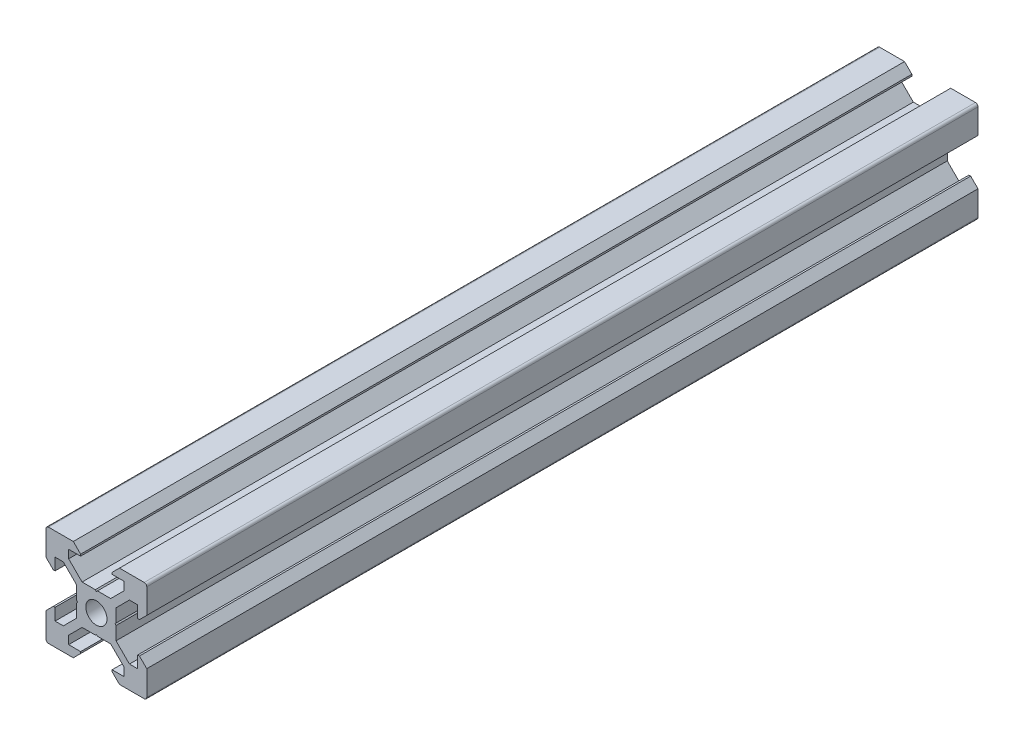
from build123d import *

# Parameters (mm, degrees)
V_SLOT_START                           = -5.085646751
V_SLOT_20X20X500_LINEAR_RAIL_OUTLINE_R = 2.1
V_SLOT_20X20X500_LINEAR_RAIL_DEPTH     = 500
SKETCH1_W                              = 20
SKETCH1_H                              = 335
CUT_EXTRUDE1_DEPTH                     = 497.589794047


# Read off the part's stored shape, not the designer's step: V-Slot 20x20x500 Linear Rail
with BuildPart() as part:
    # V-Slot 20x20x500 Linear Rail outline → V-Slot 20x20x500 Linear Rail (new body)
    with BuildSketch(Plane.XY.offset(V_SLOT_START)):
        with BuildLine():
            Line((-21.613469268, 24.462926439), (-21.613469268, 27.092266268))
            Line((-21.613469268, 27.092266268), (-21.823469268, 27.302266268))
            Line((-21.823469268, 27.302266268), (-21.613469268, 27.512266268))
            Line((-21.613469268, 27.512266268), (-21.613469268, 30.141606096))
            Line((-21.613469268, 30.141606096), (-18.952809096, 32.802266268))
            Line((-18.952809096, 32.802266268), (-17.313469268, 32.802266268))
            Line((-17.313469268, 32.802266268), (-17.313469268, 30.427266268))
            Line((-17.313469268, 30.427266268), (-16.968469268, 30.427266268))
            Line((-16.968469268, 30.427266268), (-15.513469268, 31.882266268))
            Line((-15.513469268, 31.882266268), (-15.513469268, 36.802266268))
            ThreePointArc((-15.513469268, 36.802266268), (-15.659915878, 37.155819658), (-16.013469268, 37.302266268))
            Line((-16.013469268, 37.302266268), (-20.933469268, 37.302266268))
            Line((-20.933469268, 37.302266268), (-22.388469268, 35.847266268))
            Line((-22.388469268, 35.847266268), (-22.388469268, 35.502266268))
            Line((-22.388469268, 35.502266268), (-20.013469268, 35.502266268))
            Line((-20.013469268, 35.502266268), (-20.013469268, 33.862926439))
            Line((-20.013469268, 33.862926439), (-22.67412944, 31.202266268))
            Line((-22.67412944, 31.202266268), (-25.303469268, 31.202266268))
            Line((-25.303469268, 31.202266268), (-25.513469268, 30.992266268))
            Line((-25.513469268, 30.992266268), (-25.723469268, 31.202266268))
            Line((-25.723469268, 31.202266268), (-28.352809096, 31.202266268))
            Line((-28.352809096, 31.202266268), (-31.013469268, 33.862926439))
            Line((-31.013469268, 33.862926439), (-31.013469268, 35.502266268))
            Line((-31.013469268, 35.502266268), (-28.638469268, 35.502266268))
            Line((-28.638469268, 35.502266268), (-28.638469268, 35.847266268))
            Line((-28.638469268, 35.847266268), (-30.093469268, 37.302266268))
            Line((-30.093469268, 37.302266268), (-35.013469268, 37.302266268))
            ThreePointArc((-35.013469268, 37.302266268), (-35.367022659, 37.155819658), (-35.513469268, 36.802266268))
            Line((-35.513469268, 36.802266268), (-35.513469268, 31.882266268))
            Line((-35.513469268, 31.882266268), (-34.058469268, 30.427266268))
            Line((-34.058469268, 30.427266268), (-33.713469268, 30.427266268))
            Line((-33.713469268, 30.427266268), (-33.713469268, 32.802266268))
            Line((-33.713469268, 32.802266268), (-32.07412944, 32.802266268))
            Line((-32.07412944, 32.802266268), (-29.413469268, 30.141606096))
            Line((-29.413469268, 30.141606096), (-29.413469268, 27.512266268))
            Line((-29.413469268, 27.512266268), (-29.203469268, 27.302266268))
            Line((-29.203469268, 27.302266268), (-29.413469268, 27.092266268))
            Line((-29.413469268, 27.092266268), (-29.413469268, 24.462926439))
            Line((-29.413469268, 24.462926439), (-32.07412944, 21.802266268))
            Line((-32.07412944, 21.802266268), (-33.713469268, 21.802266268))
            Line((-33.713469268, 21.802266268), (-33.713469268, 24.177266268))
            Line((-33.713469268, 24.177266268), (-34.058469268, 24.177266268))
            Line((-34.058469268, 24.177266268), (-35.513469268, 22.722266268))
            Line((-35.513469268, 22.722266268), (-35.513469268, 17.802266268))
            ThreePointArc((-35.513469268, 17.802266268), (-35.367022659, 17.448712877), (-35.013469268, 17.302266268))
            Line((-35.013469268, 17.302266268), (-30.093469268, 17.302266268))
            Line((-30.093469268, 17.302266268), (-28.638469268, 18.757266268))
            Line((-28.638469268, 18.757266268), (-28.638469268, 19.102266268))
            Line((-28.638469268, 19.102266268), (-31.013469268, 19.102266268))
            Line((-31.013469268, 19.102266268), (-31.013469268, 20.741606096))
            Line((-31.013469268, 20.741606096), (-28.352809096, 23.402266268))
            Line((-28.352809096, 23.402266268), (-25.723469268, 23.402266268))
            Line((-25.723469268, 23.402266268), (-25.513469268, 23.612266268))
            Line((-25.513469268, 23.612266268), (-25.303469268, 23.402266268))
            Line((-25.303469268, 23.402266268), (-22.67412944, 23.402266268))
            Line((-22.67412944, 23.402266268), (-20.013469268, 20.741606096))
            Line((-20.013469268, 20.741606096), (-20.013469268, 19.102266268))
            Line((-20.013469268, 19.102266268), (-22.388469268, 19.102266268))
            Line((-22.388469268, 19.102266268), (-22.388469268, 18.757266268))
            Line((-22.388469268, 18.757266268), (-20.933469268, 17.302266268))
            Line((-20.933469268, 17.302266268), (-16.013469268, 17.302266268))
            ThreePointArc((-16.013469268, 17.302266268), (-15.659915877, 17.448712878), (-15.513469268, 17.802266268))
            Line((-15.513469268, 17.802266268), (-15.513469268, 22.722266268))
            Line((-15.513469268, 22.722266268), (-16.968469268, 24.177266268))
            Line((-16.968469268, 24.177266268), (-17.313469268, 24.177266268))
            Line((-17.313469268, 24.177266268), (-17.313469268, 21.802266268))
            Line((-17.313469268, 21.802266268), (-18.952809096, 21.802266268))
            Line((-18.952809096, 21.802266268), (-21.613469268, 24.462926439))
        make_face()
        with Locations((-25.513469268, 27.302266268)):
            Circle(V_SLOT_20X20X500_LINEAR_RAIL_OUTLINE_R, mode=Mode.SUBTRACT)
    extrude(amount=V_SLOT_20X20X500_LINEAR_RAIL_DEPTH)

    # Sketch1 → Cut-Extrude1 (cut, through all)
    with BuildSketch(Plane(origin=(0, 37.302266268, 0), x_dir=(1, 0, 0), z_dir=(0, 1, 0))):
        with Locations((-25.513469268, -327.414353249)):
            Rectangle(SKETCH1_W, SKETCH1_H)
    extrude(amount=-CUT_EXTRUDE1_DEPTH, mode=Mode.SUBTRACT)


solid = part.part
